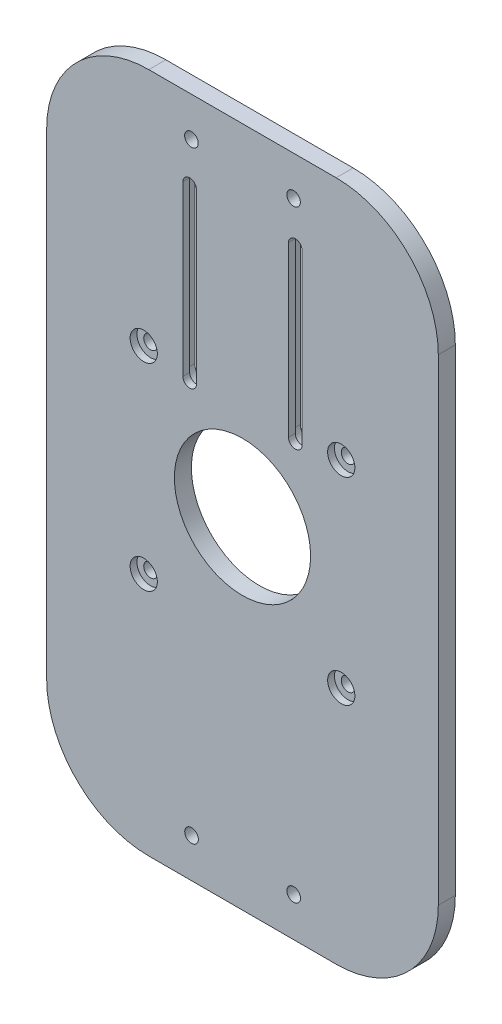
from build123d import *

# Parameters (mm, degrees)
SKETCH1_W           = 200
SKETCH1_H           = 115
SKETCH1_R           = 20
BOSS_EXTRUDE1_DEPTH = 5
CUT_EXTRUDE1_REACH  = 117.461
SKETCH4_R           = 2
SKETCH5_R           = 4
CUT_EXTRUDE2_DEPTH  = 2
FILLET1_R           = 30
SKETCH8_R           = 2
CUT_EXTRUDE4_DEPTH  = 116.461032388
CUT_EXTRUDE5_DEPTH  = 116.461032388
CUT_EXTRUDE6_DEPTH  = 3


with BuildPart() as part:
    # Sketch1 → Boss-Extrude1 (new body)
    with BuildSketch(Plane(origin=(0, 0, 0), x_dir=(0, 1, 0), z_dir=(0, 0, 1))):
        Rectangle(SKETCH1_W, SKETCH1_H)
        Circle(SKETCH1_R, mode=Mode.SUBTRACT)
    extrude(amount=BOSS_EXTRUDE1_DEPTH)

    # Sketch4 → Cut-Extrude1 (cut, up to next)
    with BuildSketch(Plane.XY.offset(5), mode=Mode.PRIVATE) as cut_extrude1_sk1:
        with Locations((29, 29)):
            Circle(SKETCH4_R)
    cut_extrude1_tool1 = extrude(cut_extrude1_sk1.sketch, amount=-CUT_EXTRUDE1_REACH, mode=Mode.PRIVATE) & part.part
    # Sketch4 → Cut-Extrude1 (cut, up to next)
    with BuildSketch(Plane.XY.offset(5), mode=Mode.PRIVATE) as cut_extrude1_sk2:
        with Locations((-29, 29)):
            Circle(SKETCH4_R)
    cut_extrude1_tool2 = extrude(cut_extrude1_sk2.sketch, amount=-CUT_EXTRUDE1_REACH, mode=Mode.PRIVATE) & part.part
    # Sketch4 → Cut-Extrude1 (cut, up to next)
    with BuildSketch(Plane.XY.offset(5), mode=Mode.PRIVATE) as cut_extrude1_sk3:
        with Locations((-29, -29)):
            Circle(SKETCH4_R)
    cut_extrude1_tool3 = extrude(cut_extrude1_sk3.sketch, amount=-CUT_EXTRUDE1_REACH, mode=Mode.PRIVATE) & part.part
    # Sketch4 → Cut-Extrude1 (cut, up to next)
    with BuildSketch(Plane.XY.offset(5), mode=Mode.PRIVATE) as cut_extrude1_sk4:
        with Locations((29, -29)):
            Circle(SKETCH4_R)
    cut_extrude1_tool4 = extrude(cut_extrude1_sk4.sketch, amount=-CUT_EXTRUDE1_REACH, mode=Mode.PRIVATE) & part.part
    add(cut_extrude1_tool1.solids().sort_by_distance((29, 29, 5))[0], mode=Mode.SUBTRACT)
    add(cut_extrude1_tool2.solids().sort_by_distance((-29, 29, 5))[0], mode=Mode.SUBTRACT)
    add(cut_extrude1_tool3.solids().sort_by_distance((-29, -29, 5))[0], mode=Mode.SUBTRACT)
    add(cut_extrude1_tool4.solids().sort_by_distance((29, -29, 5))[0], mode=Mode.SUBTRACT)

    # Sketch5 → Cut-Extrude2 (cut)
    with BuildSketch(Plane.XY.offset(5)):
        with Locations((-29, -29)):
            Circle(SKETCH5_R)
        with Locations((-29, 29)):
            Circle(SKETCH5_R)
        with Locations((29, -29)):
            Circle(SKETCH5_R)
        with Locations((29, 29)):
            Circle(SKETCH5_R)
    extrude(amount=-CUT_EXTRUDE2_DEPTH, mode=Mode.SUBTRACT)

    # Fillet1
    fillet1_edges = [part.edges().sort_by_distance(p)[0] for p in [
        (57.5, 100, 2.5),
        (-57.5, 100, 2.5),
        (-57.5, -100, 2.5),
        (57.5, -100, 2.5),
    ]]
    fillet(fillet1_edges, radius=FILLET1_R)

    # Sketch8 → Cut-Extrude4 (cut, through all)
    with BuildSketch(Plane.XY.offset(5)):
        with Locations((15, 88.5)):
            Circle(SKETCH8_R)
        with Locations((-15, 88.5)):
            Circle(SKETCH8_R)
        with Locations((-14.960853972, -88.5)):
            Circle(SKETCH8_R)
        with Locations((15.039146028, -88.5)):
            Circle(SKETCH8_R)
    extrude(amount=-CUT_EXTRUDE4_DEPTH, mode=Mode.SUBTRACT)

    # Sketch9 → Cut-Extrude5 (cut, through all)
    with BuildSketch(Plane.XY.offset(5)):
        with BuildLine():
            Line((-17.5, 76.5), (-17.5, 26.999999139))
            ThreePointArc((-17.5, 26.999999139), (-15.5, 25), (-13.5, 26.999999139))
            Line((-13.5, 26.999999139), (-13.5, 76.5))
            ThreePointArc((-13.5, 76.5), (-15.5, 78.499999139), (-17.5, 76.5))
        make_face()
        with BuildLine():
            Line((17.5, 76.5), (17.5, 26.999999139))
            ThreePointArc((17.5, 26.999999139), (15.5, 25), (13.5, 26.999999139))
            Line((13.5, 26.999999139), (13.5, 76.5))
            ThreePointArc((13.5, 76.5), (15.5, 78.499999139), (17.5, 76.5))
        make_face()
    extrude(amount=-CUT_EXTRUDE5_DEPTH, mode=Mode.SUBTRACT)

    # Sketch10 → Cut-Extrude6 (cut)
    with BuildSketch(Plane(origin=(0, 0, 0), x_dir=(1, 0, 0), z_dir=(0, 0, -1))):
        with BuildLine():
            Line((-12, -76.500000961), (-12, -26.999998493))
            ThreePointArc((-12, -26.999998493), (-15.5, -23.5), (-19, -26.999998493))
            Line((-19, -26.999998493), (-19, -76.5))
            ThreePointArc((-19, -76.5), (-15.50000048, -79.999998719), (-12, -76.500000961))
        make_face()
        with BuildLine():
            Line((12, -76.500000961), (12, -26.999998493))
            ThreePointArc((12, -26.999998493), (15.5, -23.5), (19, -26.999998493))
            Line((19, -26.999998493), (19, -76.5))
            ThreePointArc((19, -76.5), (15.50000048, -79.999998719), (12, -76.500000961))
        make_face()
    extrude(amount=-CUT_EXTRUDE6_DEPTH, mode=Mode.SUBTRACT)


solid = part.part
